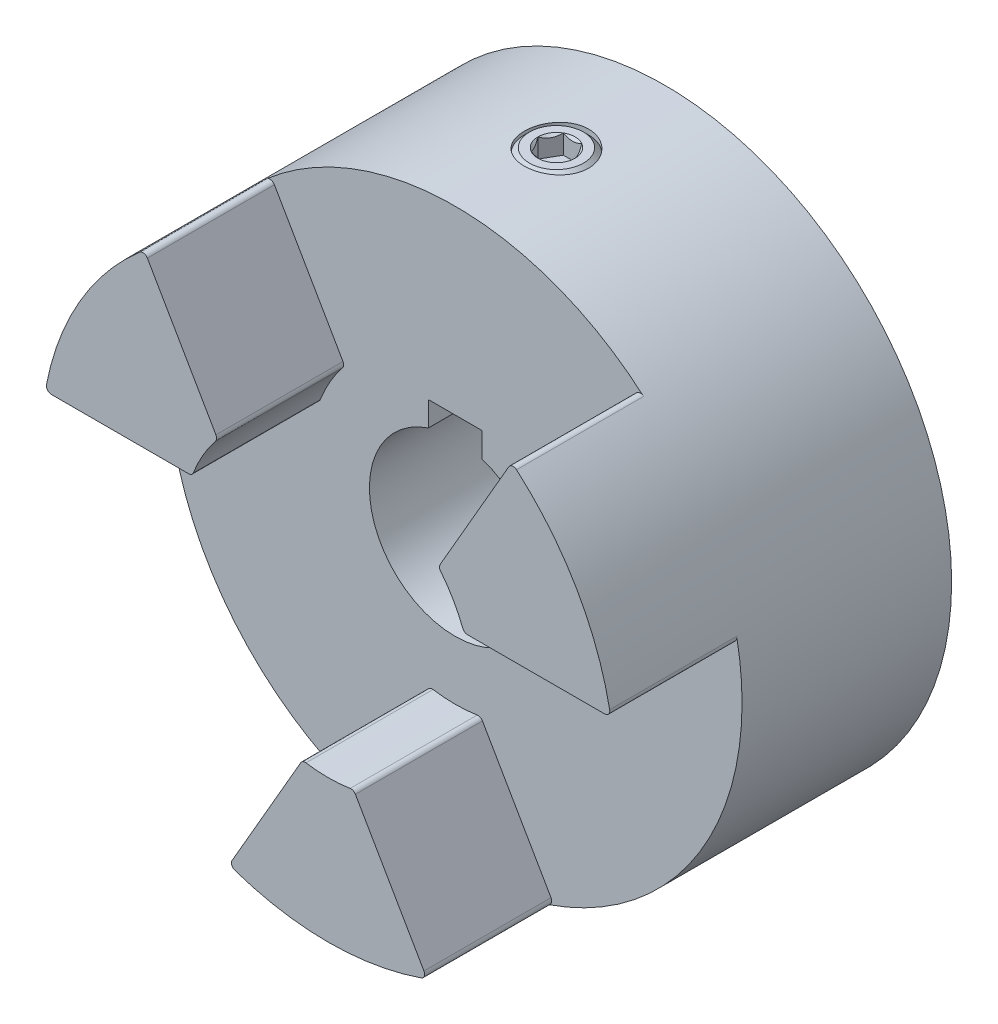
from build123d import *
from OCP.BRepFilletAPI import BRepFilletAPI_MakeChamfer

# Parameters (mm, degrees)
BOSS_EXTRUDE1_START      = -6.746875
SKETCH1_R                = 26.7890625
BOSS_EXTRUDE1_DEPTH      = 20.6375
BOSS_EXTRUDE2_DEPTH      = 11.8618
FILLET1_R                = 0.476990821
CIRPATTERN1_COUNT        = 3
FILLET1_OF_CIRPATTERN1_R = 0.476990821
CUT_EXTRUDE5_DEPTH       = 47.746248335
CUT_EXTRUDE5_DEPTH_BACK  = 47.746248335
SKETCH15_R               = 8
CHAMFER1_SIZE            = 1.0715625
CHAMFER1_SIZE2           = 1.588656738
CUT_EXTRUDE1_DEPTH       = 47.746248335
CUT_EXTRUDE1_DEPTH_BACK  = 47.746248335
SKETCH5_R                = 3
CUT_EXTRUDE2_DEPTH       = 47.746248335
SKETCH6_R                = 3
BOSS_EXTRUDE3_DEPTH      = 8
CUT_EXTRUDE3_DEPTH       = 1.8
CHAMFER3_SIZE            = 0.48
CHAMFER4_SIZE            = 1.02


with BuildPart() as part:
    # Sketch1 → Boss-Extrude1 (new body)
    with BuildSketch(Plane.XY.offset(BOSS_EXTRUDE1_START)):
        Circle(SKETCH1_R)
    extrude(amount=-BOSS_EXTRUDE1_DEPTH)

    # Sketch2 → Boss-Extrude2 (add)
    with BuildSketch(Plane.XY.offset(-6.746875)):
        with BuildLine():
            Line((-9.238549561, -25.145637229), (-2.384954104, -13.274861682))
            ThreePointArc((-2.384954104, -13.274861682), (0, -13.4874), (2.384954104, -13.274861682))
            Line((2.384954104, -13.274861682), (9.238549561, -25.145637229))
            ThreePointArc((9.238549561, -25.145637229), (0, -26.7890625), (-9.238549561, -25.145637229))
        make_face()
    boss_extrude2 = extrude(amount=BOSS_EXTRUDE2_DEPTH)

    # Fillet1
    # the kernel refuses this fillet: 0.476990821 mm, written as the material it takes off along each edge
    with BuildSketch(Plane(origin=(-9.238549561, -25.145637229, -6.746875), x_dir=(0.9423194959651416, -0.33471475546202245, 0), z_dir=(0, 0, 1))) as fillet1_piece_1:
        with BuildLine():
            CenterArc((0.572952448, 0.476963054), FILLET1_R, 169.55519331, 101.063030663)
            Line((0.103865366, 0.563435893), (0, 0))
            ThreePointArc((0, 0), (0.28904955, -0.001559444), (0.5780991, 0))
        make_face()
    extrude(amount=13.307047751, mode=Mode.SUBTRACT)
    with BuildSketch(Plane(origin=(9.238549561, -25.145637229, -6.746875), x_dir=(-0.9423194959651411, -0.3347147554620237, 0), z_dir=(0, 0, 1))) as fillet1_piece_2:
        with BuildLine():
            CenterArc((0.572952448, -0.476963054), FILLET1_R, 89.381776027, 101.063030663)
            Line((0.103865366, -0.563435893), (0, 0))
            ThreePointArc((0, 0), (0.28904955, 0.001559444), (0.5780991, 0))
        make_face()
    extrude(amount=13.307047751, mode=Mode.SUBTRACT)
    with BuildSketch(Plane(origin=(2.384954104, -13.274861682, -6.746875), x_dir=(0.49999999999999706, -0.8660254037844404, 0), z_dir=(0, 0, 1))) as fillet1_piece_3:
        with BuildLine():
            CenterArc((0.330829178, -0.476990821), FILLET1_R, 90, 68.803855098)
            ThreePointArc((-0.113892323, -0.304529143), (-0.056028498, -0.152607773), (0, 0))
            Line((0, 0), (0.330829178, 0))
        make_face()
    extrude(amount=12.688872944, mode=Mode.SUBTRACT)
    with BuildSketch(Plane(origin=(-2.384954104, -13.274861682, -6.746875), x_dir=(0.9863015455813384, -0.16495229972286882, 0), z_dir=(0, 0, 1))) as fillet1_piece_4:
        with BuildLine():
            CenterArc((0.330879129, -0.476956172), FILLET1_R, 90.690608377, 68.803855098)
            Line((-0.115888763, -0.309867293), (0, 0))
            ThreePointArc((0, 0), (0.162564956, -0.000979741), (0.325129912, 0))
        make_face()
    extrude(amount=12.688872944, mode=Mode.SUBTRACT)

    # CirPattern1: Boss-Extrude2 ×3 about axis
    cirpattern1_axis = Axis((0, 0, 0), (0, 0, 1))
    for i in range(1, CIRPATTERN1_COUNT):
        add(boss_extrude2.rotate(cirpattern1_axis, i * 360 / CIRPATTERN1_COUNT))

    # Fillet1 of CirPattern1
    # the kernel refuses this fillet: 0.476990821 mm, written as the material it takes off along each edge
    with BuildSketch(Plane(origin=(26.396035415, 4.572, -6.746875), x_dir=(-0.18128826673094764, 0.9834299997181745, 0), z_dir=(0, 0, 1)), Plane(origin=(-17.157485854, 20.573637229, -6.746875), x_dir=(-0.761031229234182, -0.6487152442561451, 0), z_dir=(0, 0, 1))) as fillet1_of_cirpattern1_piece_1:
        with BuildLine():
            CenterArc((0.572952448, 0.476963054), FILLET1_OF_CIRPATTERN1_R, 169.55519331, 101.063030663)
            Line((0.103865366, 0.563435893), (0, 0))
            ThreePointArc((0, 0), (0.28904955, -0.001559444), (0.5780991, 0))
        make_face()
    extrude(amount=13.307047751, mode=Mode.SUBTRACT)
    with BuildSketch(Plane(origin=(17.157485854, 20.573637229, -6.746875), x_dir=(0.7610312292341833, -0.6487152442561435, 0), z_dir=(0, 0, 1)), Plane(origin=(-26.396035415, 4.572, -6.746875), x_dir=(0.181288266730962, 0.9834299997181718, 0), z_dir=(0, 0, 1))) as fillet1_of_cirpattern1_piece_2:
        with BuildLine():
            CenterArc((0.572952448, -0.476963054), FILLET1_OF_CIRPATTERN1_R, 89.381776027, 101.063030663)
            Line((0.103865366, -0.563435893), (0, 0))
            ThreePointArc((0, 0), (0.28904955, 0.001559444), (0.5780991, 0))
        make_face()
    extrude(amount=13.307047751, mode=Mode.SUBTRACT)
    with BuildSketch(Plane(origin=(10.303890396, 8.702861682, -6.746875), x_dir=(0.5000000000000006, 0.8660254037844383, 0), z_dir=(0, 0, 1)), Plane(origin=(-12.688844501, 4.572, -6.746875), x_dir=(-1, 0, 0), z_dir=(0, 0, 1))) as fillet1_of_cirpattern1_piece_3:
        with BuildLine():
            CenterArc((0.330829178, -0.476990821), FILLET1_OF_CIRPATTERN1_R, 90, 68.803855098)
            ThreePointArc((-0.113892323, -0.304529143), (-0.056028498, -0.152607773), (0, 0))
            Line((0, 0), (0.330829178, 0))
        make_face()
    extrude(amount=12.688872944, mode=Mode.SUBTRACT)
    with BuildSketch(Plane(origin=(12.688844501, 4.572, -6.746875), x_dir=(-0.3502978908180006, 0.9366383441267288, 0), z_dir=(0, 0, 1)), Plane(origin=(-10.303890396, 8.702861682, -6.746875), x_dir=(-0.6360036547633316, -0.7716860444038657, 0), z_dir=(0, 0, 1))) as fillet1_of_cirpattern1_piece_4:
        with BuildLine():
            CenterArc((0.330879129, -0.476956172), FILLET1_OF_CIRPATTERN1_R, 90.690608377, 68.803855098)
            Line((-0.115888763, -0.309867293), (0, 0))
            ThreePointArc((0, 0), (0.162564956, -0.000979741), (0.325129912, 0))
        make_face()
    extrude(amount=12.688872944, mode=Mode.SUBTRACT)

    # Sketch15 → Cut-Extrude5 (cut, two sides: drawn at the far end of the back side and taken through both)
    with BuildSketch(Plane.XY.offset(-CUT_EXTRUDE5_DEPTH_BACK)):
        Circle(SKETCH15_R)
    extrude(amount=CUT_EXTRUDE5_DEPTH + CUT_EXTRUDE5_DEPTH_BACK, mode=Mode.SUBTRACT)

    # Chamfer1: one chamfer whose edges measure the first distance from different faces: ONE call of the kernel's chamfer builder (chamfer() names one face for all edges)
    chamfer1_edges_1 = [part.edges().sort_by_distance(p)[0] for p in [
        (-26.7890625, 0, -27.384375),
    ]]
    chamfer1_side_1 = [part.faces().sort_by_distance(p)[0] for p in [
        (-26.7890625, 0, -17.065625),
    ]]
    chamfer1_edges_2 = [part.edges().sort_by_distance(p)[0] for p in [
        (-8, 0, -27.384375),
    ]]
    chamfer1_side_2 = [part.faces().sort_by_distance(p)[0] for p in [
        (-8, 0, -17.065625),
    ]]
    chamfer1 = BRepFilletAPI_MakeChamfer(part.part.solid().wrapped)
    for e in chamfer1_edges_1:
        chamfer1.Add(CHAMFER1_SIZE, CHAMFER1_SIZE2, e.wrapped, chamfer1_side_1[0].wrapped)  # the first distance lies on this face
    for e in chamfer1_edges_2:
        chamfer1.Add(CHAMFER1_SIZE, CHAMFER1_SIZE2, e.wrapped, chamfer1_side_2[0].wrapped)  # the first distance lies on this face
    add(Compound.cast(chamfer1.Shape()), mode=Mode.REPLACE)

    # Sketch4 → Cut-Extrude1 (cut, two sides: drawn at the far end of the back side and taken through both)
    with BuildSketch(Plane.XY.offset(-CUT_EXTRUDE1_DEPTH_BACK)):
        with BuildLine():
            Line((-2.5, 9.899342077), (2.5, 9.899342077))
            Line((2.5, 9.899342077), (2.5, 7.599342077))
            ThreePointArc((2.5, 7.599342077), (0, 8), (-2.5, 7.599342077))
            Line((-2.5, 7.599342077), (-2.5, 9.899342077))
        make_face()
    extrude(amount=CUT_EXTRUDE1_DEPTH + CUT_EXTRUDE1_DEPTH_BACK, mode=Mode.SUBTRACT)

    # Sketch5 → Cut-Extrude2 (cut, through all)
    with BuildSketch(Plane(origin=(0, 0, 0), x_dir=(1, 0, 0), z_dir=(0, 1, 0))):
        with Locations(Location((0, 16.208375, 0), (0, 0, 90))):
            Circle(SKETCH5_R)
    extrude(amount=CUT_EXTRUDE2_DEPTH, mode=Mode.SUBTRACT)


with BuildPart() as body_2:
    # Sketch6 → Boss-Extrude3 (new body)
    with BuildSketch(Plane(origin=(0, 26.7890625, 0), x_dir=(-1, 0, 0), z_dir=(0, 1, 0))):
        with Locations(Location((0, -16.208375, 0), (0, 0, 90))):
            Circle(SKETCH6_R)
    extrude(amount=-BOSS_EXTRUDE3_DEPTH)

    # Sketch8 → Cut-Extrude3 (cut)
    with BuildSketch(Plane(origin=(0, 26.7890625, 0), x_dir=(1, 0, 0), z_dir=(0, 1, 0))):
        Polygon((0.866025404, 14.708375), (1.732050808, 16.208375), (0.866025404, 17.708375), (-0.866025404, 17.708375), (-1.732050808, 16.208375), (-0.866025404, 14.708375), align=None)
    extrude(amount=-CUT_EXTRUDE3_DEPTH, mode=Mode.SUBTRACT)

    # Cut-Extrude4 cone 1 section (through the dimple's axis) → Cut-Extrude4 (revolve, cut)
    with BuildSketch(Plane(origin=(0, 26.7890625, -16.208375), x_dir=(0, 0, 1), z_dir=(1, 0, 0))):
        Polygon((0, 0), (1.732050808, 0), (0, 1.732050808), align=None)
    revolve(axis=Axis((0, 26.7890625, -16.208375), (0, -1, 0)), mode=Mode.SUBTRACT)

    # Chamfer3
    chamfer3_edges = [body_2.edges().sort_by_distance(p)[0] for p in [
        (0, 26.7890625, -19.208375),
    ]]
    chamfer(chamfer3_edges, length=CHAMFER3_SIZE)

    # Chamfer4
    chamfer4_edges = [body_2.edges().sort_by_distance(p)[0] for p in [
        (0, 18.7890625, -19.208375),
    ]]
    chamfer(chamfer4_edges, length=CHAMFER4_SIZE)


solid = Compound([part.part, body_2.part])
